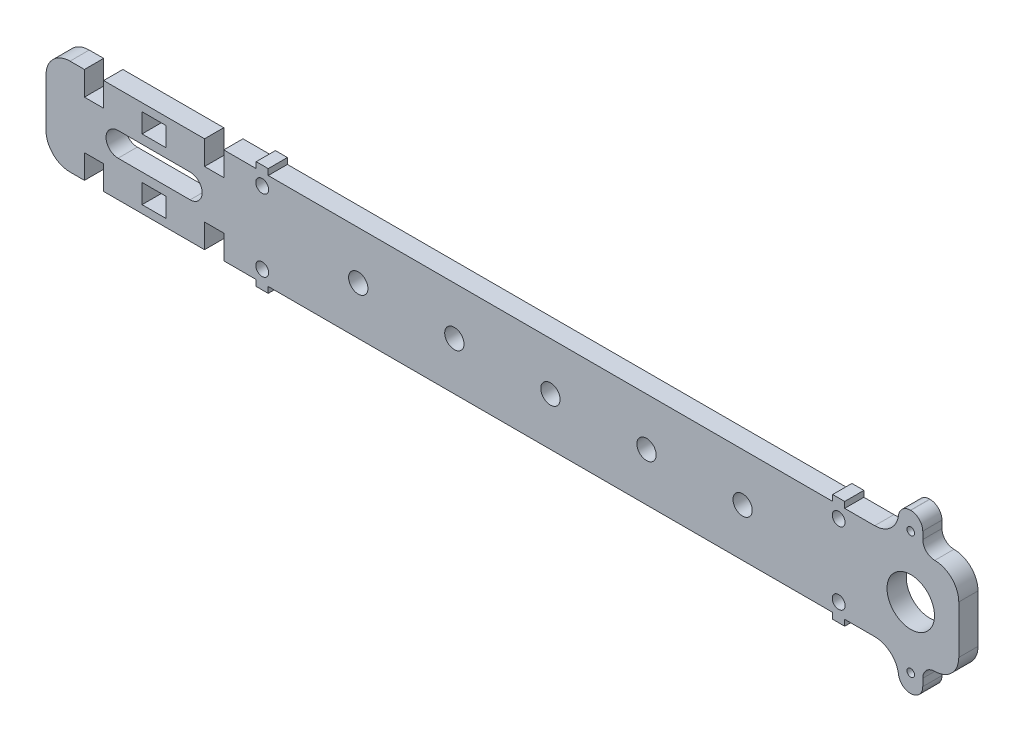
from build123d import *

# Parameters (mm, degrees)
SKETCH2_W           = 6.35
SKETCH2_H           = 5.08
SKETCH2_R           = 1.7
SKETCH2_R_2         = 2.5527
SKETCH2_R_3         = 1
SKETCH2_R_4         = 6.275
BOSS_EXTRUDE1_DEPTH = 5.08
FILLET1_R           = 6.35
FILLET2_R           = 3.175


with BuildPart() as part:
    # Sketch2 → Boss-Extrude1 (new body)
    with BuildSketch(Plane.XY):
        Polygon((-110.49, 12.7), (-120.65, 12.7), (-120.65, -12.7), (-110.49, -12.7), (-110.49, -6.35), (-105.41, -6.35), (-105.41, -12.7), (-78.74, -12.7), (-78.74, -6.35), (-73.66, -6.35), (-73.66, -12.7), (-65.0875, -12.7), (-65.0875, -14.2875), (-61.9125, -14.2875), (-61.9125, -12.7), (87.3125, -12.7), (87.3125, -14.2875), (90.4875, -14.2875), (90.4875, -12.7), (104.775, -12.7), (104.775, -20.9775), (111.125, -20.9775), (111.125, -12.7), (120.65, -12.7), (120.65, 12.7), (111.125, 12.7), (111.125, 20.9775), (104.775, 20.9775), (104.775, 12.7), (90.4875, 12.7), (90.4875, 14.2875), (87.3125, 14.2875), (87.3125, 12.7), (-61.9125, 12.7), (-61.9125, 14.2875), (-65.0875, 14.2875), (-65.0875, 12.7), (-73.66, 12.7), (-73.66, 6.35), (-78.74, 6.35), (-78.74, 12.7), (-105.41, 12.7), (-105.41, 6.35), (-110.49, 6.35), align=None)
        with Locations((-92.075, -8.09625)):
            Rectangle(SKETCH2_W, SKETCH2_H, mode=Mode.SUBTRACT)
        with Locations((-63.5, -9.525)):
            Circle(SKETCH2_R, mode=Mode.SUBTRACT)
        with BuildLine():
            ThreePointArc((-101.6, -3.175), (-104.775, 0), (-101.6, 3.175))
            Line((-101.6, 3.175), (-82.55, 3.175))
            ThreePointArc((-82.55, 3.175), (-79.375, 0), (-82.55, -3.175))
            Line((-82.55, -3.175), (-101.6, -3.175))
        make_face(mode=Mode.SUBTRACT)
        with Locations((-38.1, 0)):
            Circle(SKETCH2_R_2, mode=Mode.SUBTRACT)
        with Locations((-12.7, 0)):
            Circle(SKETCH2_R_2, mode=Mode.SUBTRACT)
        with Locations((107.95, -16.215)):
            Circle(SKETCH2_R_3, mode=Mode.SUBTRACT)
        with Locations((12.7, 0)):
            Circle(SKETCH2_R_2, mode=Mode.SUBTRACT)
        with Locations((38.1, 0)):
            Circle(SKETCH2_R_2, mode=Mode.SUBTRACT)
        with Locations((88.9, -9.525)):
            Circle(SKETCH2_R, mode=Mode.SUBTRACT)
        with Locations((63.5, 0)):
            Circle(SKETCH2_R_2, mode=Mode.SUBTRACT)
        with Locations((107.95, 0)):
            Circle(SKETCH2_R_4, mode=Mode.SUBTRACT)
        with Locations((-92.075, 8.09625)):
            Rectangle(SKETCH2_W, SKETCH2_H, mode=Mode.SUBTRACT)
        with Locations((-63.5, 9.525)):
            Circle(SKETCH2_R, mode=Mode.SUBTRACT)
        with Locations((88.9, 9.525)):
            Circle(SKETCH2_R, mode=Mode.SUBTRACT)
        with Locations((107.95, 16.215)):
            Circle(SKETCH2_R_3, mode=Mode.SUBTRACT)
    extrude(amount=BOSS_EXTRUDE1_DEPTH)

    # Fillet1
    fillet1_edges = [part.edges().sort_by_distance(p)[0] for p in [
        (104.775, 12.7, 2.54),
        (120.65, 12.7, 2.54),
        (120.65, -12.7, 2.54),
        (104.775, -12.7, 2.54),
        (-120.65, -12.7, 2.54),
        (-120.65, 12.7, 2.54),
    ]]
    fillet(fillet1_edges, radius=FILLET1_R)

    # Fillet2
    fillet2_edges = [part.edges().sort_by_distance(p)[0] for p in [
        (104.775, -20.9775, 2.54),
        (111.125, -20.9775, 2.54),
        (111.125, -12.7, 2.54),
        (111.125, 12.7, 2.54),
        (111.125, 20.9775, 2.54),
        (104.775, 20.9775, 2.54),
    ]]
    fillet(fillet2_edges, radius=FILLET2_R - 0.0001)  # a hair under: the kernel refuses the full size


solid = part.part
